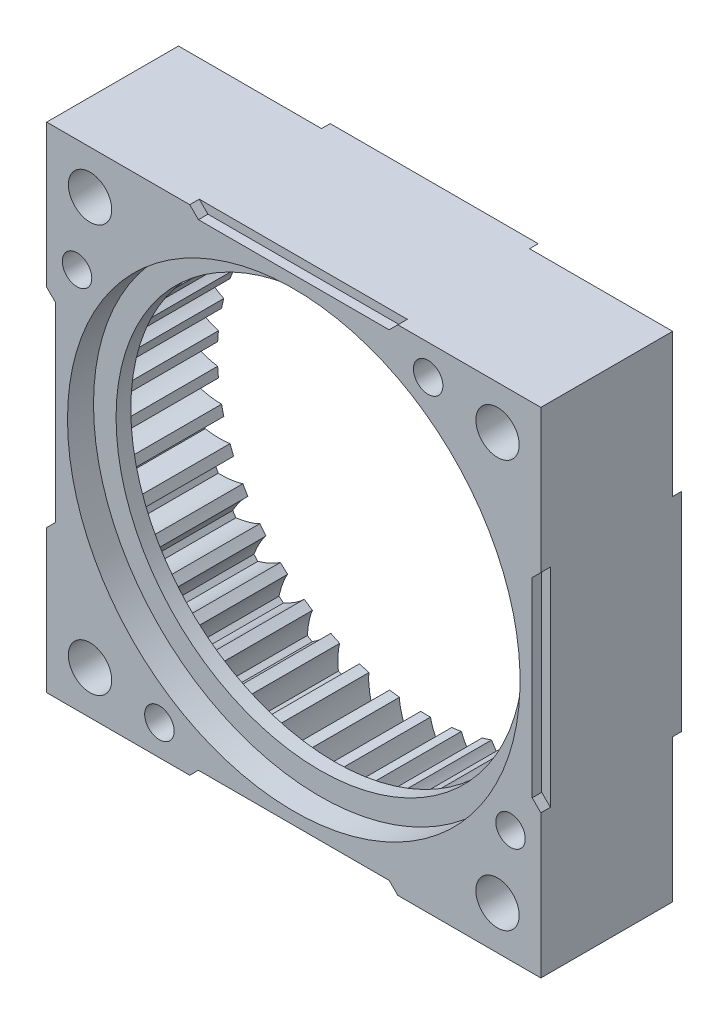
from build123d import *

# Parameters (mm, degrees)
SKETCH1_R                = 29.4
SKETCH1_R_2              = 26.7
LASHENA_DEPTH            = 10.5
CUT_EXTRUDEA_DEPTH       = 10.5
WWW_KYTOOL_CN_COUNT      = 42
CUT_EXTRUDE2_DEPTH       = 45.269176768
BOSS_EXTRUDE3_DEPTH      = 15.2
SKETCH6_R                = 2.5
SKETCH6_R_2              = 1.7
CUT_EXTRUDE3_DEPTH       = 44.075979518
BOSS_EXTRUDE4_DEPTH      = 1
FILLET1_R                = 0.2
CUT_EXTRUDE4_DEPTH       = 1.1
CIRPATTERN2_COUNT        = 4
FILLET1_OF_CIRPATTERN2_R = 0.2


with BuildPart() as part:
    # Sketch1 → LaShenA (new body)
    with BuildSketch(Plane.XY):
        with Locations(Location((0, 0, 0), (0, 0, 180))):
            Circle(SKETCH1_R)
        with Locations(Location((0, 0, 0), (0, 0, 180))):
            Circle(SKETCH1_R_2, mode=Mode.SUBTRACT)
    extrude(amount=LASHENA_DEPTH)

    # SketchA → Cut-ExtrudeA (add)
    with BuildSketch(Plane.XY.offset(10.5)):
        with BuildLine():
            ThreePointArc((0.56803113, 24), (0, 24.006721129), (-0.56803113, 24))
            add(Edge.make_bspline(
                [(-0.56803113, 24), (-0.583838136, 24.076457589), (-0.605571654, 24.179582895), (-0.637800373, 24.310283186), (-0.660121028, 24.395142963), (-0.68538066, 24.485330782), (-0.713742244, 24.580776004), (-0.745380903, 24.681400983), (-0.780466037, 24.787124801), (-0.81916646, 24.89786221), (-0.861648791, 25.013523989), (-0.908077807, 25.134016888), (-0.958616233, 25.259243694), (-1.013424695, 25.389103266), (-1.072661624, 25.523490578), (-1.136483177, 25.662296762), (-1.205043156, 25.805409158), (-1.278492927, 25.952711357), (-1.356981338, 26.104083254), (-1.440654641, 26.259401095), (-1.529656425, 26.418537534), (-1.624127488, 26.581361682), (-1.75959691, 26.806575573), (-1.86682545, 26.97550631), (-1.941100376, 27.088650417)],
                knots=[0, 0, 0, 0, 0.068895379, 0.092962782, 0.118768807, 0.146313455, 0.175596725, 0.206618617, 0.239379131, 0.273878268, 0.310116027, 0.348092409, 0.387807413, 0.429261039, 0.472453287, 0.517384158, 0.564053651, 0.612461767, 0.662608505, 0.714493865, 0.768117847, 0.823480452, 0.880581679, 1, 1, 1, 1], degree=3))
            ThreePointArc((-1.941100376, 27.088650417), (0, 27.158108404), (1.941100376, 27.088650417))
            add(Edge.make_bspline(
                [(0.56803113, 24), (0.583838136, 24.076457589), (0.605571654, 24.179582895), (0.637800373, 24.310283186), (0.660121028, 24.395142963), (0.68538066, 24.485330782), (0.713742244, 24.580776004), (0.745380903, 24.681400983), (0.780466037, 24.787124801), (0.81916646, 24.89786221), (0.861648791, 25.013523989), (0.908077807, 25.134016888), (0.958616233, 25.259243694), (1.013424695, 25.389103266), (1.072661624, 25.523490578), (1.136483177, 25.662296762), (1.205043156, 25.805409158), (1.278492927, 25.952711357), (1.356981338, 26.104083254), (1.440654641, 26.259401095), (1.529656425, 26.418537534), (1.624127488, 26.581361682), (1.75959691, 26.806575573), (1.86682545, 26.97550631), (1.941100376, 27.088650417)],
                knots=[0, 0, 0, 0, 0.068895379, 0.092962782, 0.118768807, 0.146313455, 0.175596725, 0.206618617, 0.239379131, 0.273878268, 0.310116027, 0.348092409, 0.387807413, 0.429261039, 0.472453287, 0.517384158, 0.564053651, 0.612461767, 0.662608505, 0.714493865, 0.768117847, 0.823480452, 0.880581679, 1, 1, 1, 1], degree=3))
        make_face()
    cut_extrudea = extrude(amount=-CUT_EXTRUDEA_DEPTH)

    # www.KYTool.cn: Cut-ExtrudeA ×42 about axis
    www_kytool_cn_axis = Axis((0, 0, -88.99), (0, 0, 1))
    for i in range(1, WWW_KYTOOL_CN_COUNT):
        add(cut_extrudea.rotate(www_kytool_cn_axis, i * 360 / WWW_KYTOOL_CN_COUNT))

    # Sketch4 → Revolve1 (revolve)
    with BuildSketch(Plane(origin=(0, 0, 0), x_dir=(1, 0, 0), z_dir=(0, 1, 0))):
        Polygon((-29.4, -10.5), (-29.4, -15.2), (-26.1, -15.2), (-26.1, -12.2), (-23.5, -12.2), (-23.5, -10.5), align=None)
    revolve(axis=Axis((0, 0, -88.99), (0, 0, 1)))

    # Sketch5 → Cut-Extrude2 (cut, through all)
    with BuildSketch(Plane(origin=(0, 0, 0), x_dir=(-1, 0, 0), z_dir=(0, 0, -1))):
        with BuildLine():
            Line((28.5, 7.218725649), (28.5, -7.218725649))
            ThreePointArc((28.5, -7.218725649), (29.174132378, -3.637306696), (29.4, 0))
            ThreePointArc((29.4, 0), (29.174132378, 3.637306696), (28.5, 7.218725649))
        make_face()
        with BuildLine():
            ThreePointArc((-7.218725649, -28.5), (0, -29.4), (7.218725649, -28.5))
            Line((7.218725649, -28.5), (-7.218725649, -28.5))
        make_face()
        with BuildLine():
            ThreePointArc((-28.5, 7.218725649), (-29.4, 0), (-28.5, -7.218725649))
            Line((-28.5, -7.218725649), (-28.5, 7.218725649))
        make_face()
        with BuildLine():
            Line((-7.218725649, 28.5), (7.218725649, 28.5))
            ThreePointArc((7.218725649, 28.5), (0, 29.4), (-7.218725649, 28.5))
        make_face()
    extrude(amount=-CUT_EXTRUDE2_DEPTH, mode=Mode.SUBTRACT)

    # Sketch5<5> → Boss-Extrude3 (add)
    with BuildSketch(Plane(origin=(0, 0, 0), x_dir=(-1, 0, 0), z_dir=(0, 0, -1))):
        with BuildLine():
            ThreePointArc((7.218725649, 28.5), (20.788939367, 20.788939367), (28.5, 7.218725649))
            Line((28.5, 7.218725649), (28.5, 28.5))
            Line((28.5, 28.5), (7.218725649, 28.5))
        make_face()
        with BuildLine():
            Line((-28.5, 28.5), (-28.5, 7.218725649))
            ThreePointArc((-28.5, 7.218725649), (-20.788939367, 20.788939367), (-7.218725649, 28.5))
            Line((-7.218725649, 28.5), (-28.5, 28.5))
        make_face()
        with BuildLine():
            Line((-28.5, -28.5), (-7.218725649, -28.5))
            ThreePointArc((-7.218725649, -28.5), (-20.788939367, -20.788939367), (-28.5, -7.218725649))
            Line((-28.5, -7.218725649), (-28.5, -28.5))
        make_face()
        with BuildLine():
            Line((7.218725649, -28.5), (28.5, -28.5))
            Line((28.5, -28.5), (28.5, -7.218725649))
            ThreePointArc((28.5, -7.218725649), (20.788939367, -20.788939367), (7.218725649, -28.5))
        make_face()
    extrude(amount=-BOSS_EXTRUDE3_DEPTH)

    # Sketch6 → Cut-Extrude3 (cut, through all)
    with BuildSketch(Plane(origin=(0, 0, 0), x_dir=(-1, 0, 0), z_dir=(0, 0, -1))):
        with Locations((-23.5, 23.5)):
            Circle(SKETCH6_R)
        with Locations((-15.5, 25)):
            Circle(SKETCH6_R_2)
    cut_extrude3 = extrude(amount=-CUT_EXTRUDE3_DEPTH, mode=Mode.SUBTRACT)

    # Sketch6<3> → Boss-Extrude4 (add)
    with BuildSketch(Plane(origin=(0, 0, 0), x_dir=(-1, 0, 0), z_dir=(0, 0, -1))):
        Polygon((-11, 27.5), (0, 27.5), (0, 28.5), (-12, 28.5), align=None)
        Polygon((0, 28.5), (0, 27.5), (11, 27.5), (12, 28.5), align=None)
    boss_extrude4 = extrude(amount=BOSS_EXTRUDE4_DEPTH)

    # Fillet1
    fillet1_edges = [part.edges().sort_by_distance(p)[0] for p in [
        (0, 27.5, -1),
    ]]
    fillet(fillet1_edges, radius=FILLET1_R)

    # Sketch7 → Cut-Extrude4 (cut)
    with BuildSketch(Plane.XY.offset(15.2)):
        Polygon((-11, 27.5), (11, 27.5), (12, 28.5), (-12, 28.5), align=None)
    cut_extrude4 = extrude(amount=-CUT_EXTRUDE4_DEPTH, mode=Mode.SUBTRACT)

    # CirPattern2: Cut-Extrude3, Boss-Extrude4, Cut-Extrude4 ×4 about axis
    cirpattern2_axis = Axis((0, 0, 0), (0, 0, 1))
    add([cut_extrude3.rotate(cirpattern2_axis, i * 360 / CIRPATTERN2_COUNT) for i in range(1, CIRPATTERN2_COUNT)], mode=Mode.SUBTRACT)
    add([boss_extrude4.rotate(cirpattern2_axis, i * 360 / CIRPATTERN2_COUNT) for i in range(1, CIRPATTERN2_COUNT)])
    add([cut_extrude4.rotate(cirpattern2_axis, i * 360 / CIRPATTERN2_COUNT) for i in range(1, CIRPATTERN2_COUNT)], mode=Mode.SUBTRACT)

    # Fillet1 of CirPattern2
    fillet1_of_cirpattern2_edges = [part.edges().sort_by_distance(p)[0] for p in [
        (-27.5, 0, -1),
        (0, -27.5, -1),
        (27.5, 0, -1),
    ]]
    fillet(fillet1_of_cirpattern2_edges, radius=FILLET1_OF_CIRPATTERN2_R)


solid = part.part
